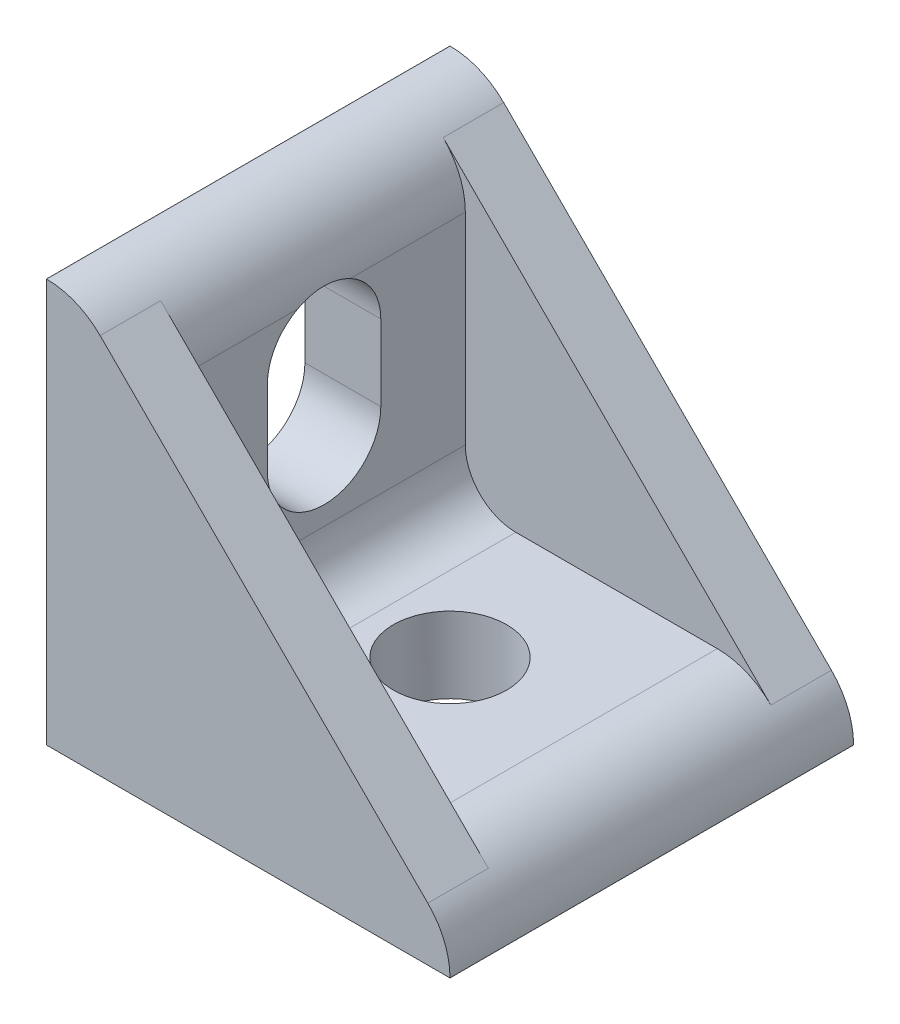
from build123d import *

# Parameters (mm, degrees)
BOSS_EXTRUDE1_DEPTH = 11.1125
CUT_EXTRUDE1_REACH  = 39.601
SKETCH4_R           = 3.5687
CUT_EXTRUDE2_DEPTH  = 38.600633818
BOSS_EXTRUDE2_START = 3.81
BOSS_EXTRUDE2_DEPTH = 3.81


with BuildPart() as part:
    # Sketch2 → Boss-Extrude1 (new, symmetric)
    with BuildSketch(Plane.XY):
        with BuildLine():
            Line((0, 0), (0, 25.4))
            Line((0, 25.4), (0.0127, 25.4))
            ThreePointArc((0.0127, 25.4), (3.380296045, 24.005096045), (4.7752, 20.6375))
            Line((4.7752, 20.6375), (4.7752, 7.9502))
            ThreePointArc((4.7752, 7.9502), (5.70513597, 5.70513597), (7.9502, 4.7752))
            Line((7.9502, 4.7752), (20.6375, 4.7752))
            ThreePointArc((20.6375, 4.7752), (24.005096045, 3.380296045), (25.4, 0.0127))
            Line((25.4, 0.0127), (25.4, 0))
            Line((25.4, 0), (0, 0))
        make_face()
    extrude(amount=BOSS_EXTRUDE1_DEPTH, both=True)

    # Sketch3 → Cut-Extrude1 (cut, up to next)
    with BuildSketch(Plane.ZY, mode=Mode.PRIVATE) as cut_extrude1_sk1:
        with BuildLine():
            Line((-3.5687, 17.4752), (-3.5687, 12.7))
            ThreePointArc((-3.5687, 12.7), (0, 9.1313), (3.5687, 12.7))
            Line((3.5687, 12.7), (3.5687, 17.4752))
            ThreePointArc((3.5687, 17.4752), (0, 21.0439), (-3.5687, 17.4752))
        make_face()
    cut_extrude1_tool1 = extrude(cut_extrude1_sk1.sketch, amount=-CUT_EXTRUDE1_REACH, mode=Mode.PRIVATE) & part.part
    add(cut_extrude1_tool1.solids().sort_by_distance((0, 15.0876, 0))[0], mode=Mode.SUBTRACT)

    # Sketch4 → Cut-Extrude2 (cut, through all)
    with BuildSketch(Plane.XZ):
        with Locations((12.7, 0)):
            Circle(SKETCH4_R)
    extrude(amount=-CUT_EXTRUDE2_DEPTH, mode=Mode.SUBTRACT)

    # Sketch7 → Boss-Extrude2 (add)
    with BuildSketch(Plane.XY.offset(-12.7).offset(BOSS_EXTRUDE2_START)):
        with BuildLine():
            Line((24.005096045, 3.380296045), (3.380296045, 24.005096045))
            ThreePointArc((3.380296045, 24.005096045), (1.835229847, 25.037476274), (0.0127, 25.4))
            Line((0.0127, 25.4), (0, 25.4))
            Line((0, 25.4), (0, 0))
            Line((0, 0), (25.4, 0))
            Line((25.4, 0), (25.4, 0.0127))
            ThreePointArc((25.4, 0.0127), (25.037476274, 1.835229847), (24.005096045, 3.380296045))
        make_face()
    boss_extrude2 = extrude(amount=-BOSS_EXTRUDE2_DEPTH)

    # Mirror1: Boss-Extrude2 across plane
    add(boss_extrude2.mirror(Plane.XY))


solid = part.part
